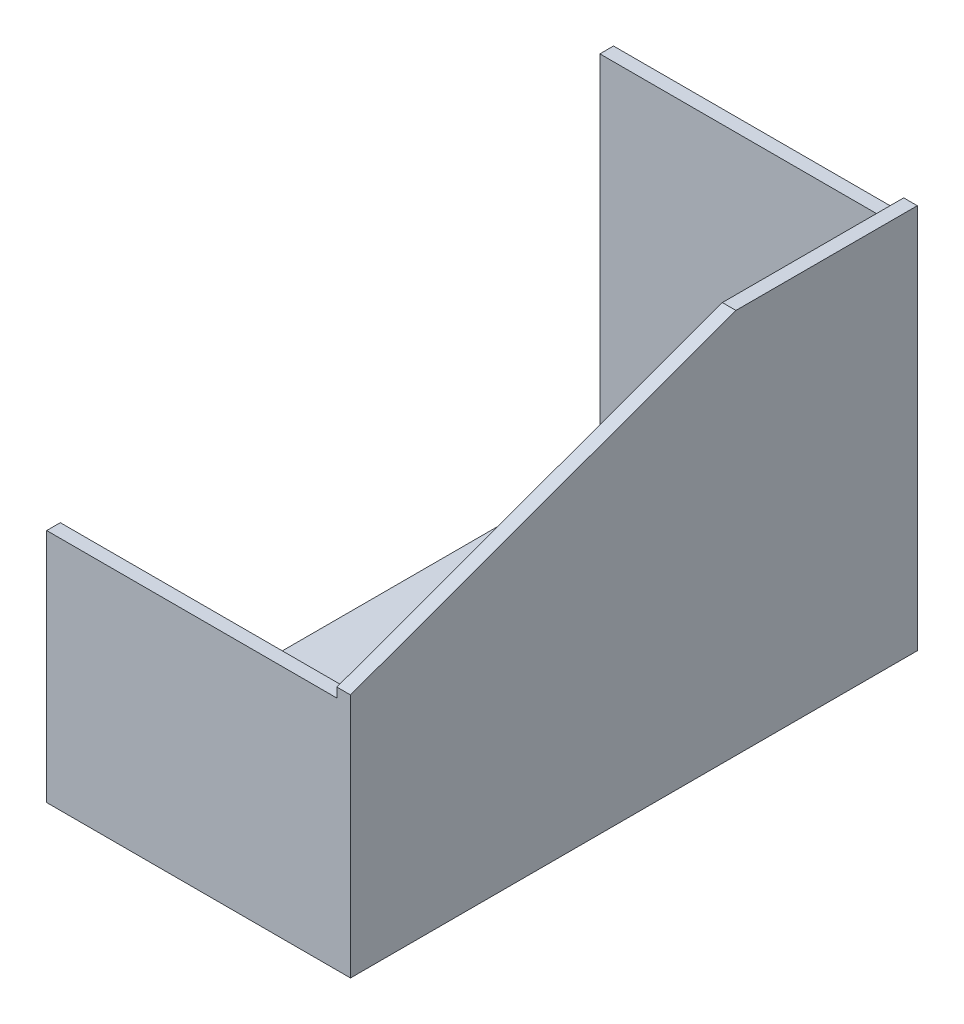
from build123d import *

# Parameters (mm, degrees)
EXTRUDE_1_DEPTH = 32
EXTRUDE_2_DEPTH = 3


with BuildPart() as part:
    # Эскиз18 → Бобышка-Вытянуть1 (new, symmetric)
    with BuildSketch(Plane(origin=(0, 0, 0), x_dir=(0, 0, -1), z_dir=(1, 0, 0))):
        Polygon((53.75, 76), (53.75, -6), (-71.25, -6), (-71.25, 45.961907473), (-68.25, 45.961907473), (-68.25, -3), (50.75, -3), (50.75, 76), align=None)
    extrude(amount=EXTRUDE_1_DEPTH, both=True)

    # Эскиз19 → Бобышка-Вытянуть2 (add)
    with BuildSketch(Plane(origin=(32, 0, 0), x_dir=(0, 0, -1), z_dir=(1, 0, 0))):
        Polygon((-71.25, 48.062530087), (13.75, 79), (53.75, 79), (53.75, -6), (-71.25, -6), align=None)
    extrude(amount=EXTRUDE_2_DEPTH)


solid = part.part
